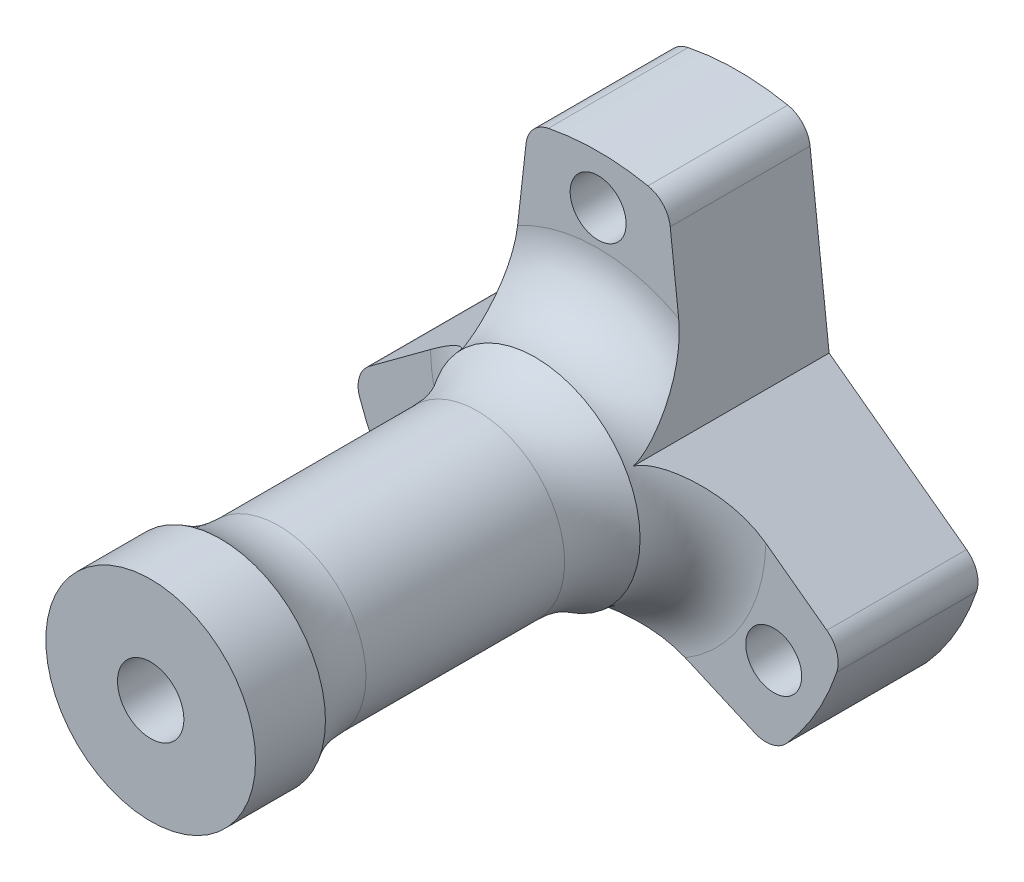
from build123d import *

# Parameters (mm, degrees)
SKETCH1_R           = 4
BOSS_EXTRUDE1_DEPTH = 20
SKETCH2_R           = 15
BOSS_EXTRUDE2_DEPTH = 9
SKETCH3_R           = 12.5
BOSS_EXTRUDE3_DEPTH = 45
SKETCH5_R           = 15
BOSS_EXTRUDE4_DEPTH = 10
FILLET3_R           = 9
FILLET4_R           = 15
SKETCH6_R           = 4.75
CUT_EXTRUDE1_DEPTH  = 20


with BuildPart() as part:
    # Sketch1 → Boss-Extrude1 (new body)
    with BuildSketch(Plane.XY):
        with BuildLine():
            Line((10.311065776, 31.812768666), (13.037811649, 7.527384065))
            Line((13.037811649, 7.527384065), (32.706198717, -6.976739431))
            ThreePointArc((32.706198717, -6.976739431), (34.146892061, -8.992770752), (34.123690383, -11.470560347))
            ThreePointArc((34.123690383, -11.470560347), (31.176914536, -18), (26.995641847, -23.816702569))
            ThreePointArc((26.995641847, -23.816702569), (24.861413952, -25.075690609), (22.395132941, -24.836029235))
            Line((22.395132941, -24.836029235), (0, -15.05476813))
            Line((0, -15.05476813), (-22.395132941, -24.836029235))
            ThreePointArc((-22.395132941, -24.836029235), (-24.861413952, -25.075690609), (-26.995641847, -23.816702569))
            ThreePointArc((-26.995641847, -23.816702569), (-31.176914536, -18), (-34.123690383, -11.470560347))
            ThreePointArc((-34.123690383, -11.470560347), (-34.146892061, -8.992770752), (-32.706198717, -6.976739431))
            Line((-32.706198717, -6.976739431), (-13.037811649, 7.527384065))
            Line((-13.037811649, 7.527384065), (-10.311065776, 31.812768666))
            ThreePointArc((-10.311065776, 31.812768666), (-9.285478109, 34.068461361), (-7.128048535, 35.287262916))
            ThreePointArc((-7.128048535, 35.287262916), (0, 36), (7.128048535, 35.287262916))
            ThreePointArc((7.128048535, 35.287262916), (9.285478109, 34.068461361), (10.311065776, 31.812768666))
        make_face()
        with Locations((0, 29)):
            Circle(SKETCH1_R, mode=Mode.SUBTRACT)
        with Locations((-25.11473671, -14.5)):
            Circle(SKETCH1_R, mode=Mode.SUBTRACT)
        with Locations((25.11473671, -14.5)):
            Circle(SKETCH1_R, mode=Mode.SUBTRACT)
    extrude(amount=BOSS_EXTRUDE1_DEPTH)

    # Sketch2 → Boss-Extrude2 (add)
    with BuildSketch(Plane.XY.offset(20)):
        with Locations(Location((0, 0, 0), (0, 0, 180))):
            Circle(SKETCH2_R)
    extrude(amount=BOSS_EXTRUDE2_DEPTH)

    # Sketch3 → Boss-Extrude3 (add)
    with BuildSketch(Plane.XY.offset(29)):
        with Locations(Location((0, 0, 0), (0, 0, 180))):
            Circle(SKETCH3_R)
    extrude(amount=BOSS_EXTRUDE3_DEPTH)

    # Sketch5 → Boss-Extrude4 (add)
    with BuildSketch(Plane.XY.offset(74)):
        with Locations(Location((0, 0, 0), (0, 0, 180))):
            Circle(SKETCH5_R)
    extrude(amount=BOSS_EXTRUDE4_DEPTH)

    # Fillet3
    # the kernel refuses this fillet: 9 mm, written as the material it adds along each edge
    with BuildSketch(Plane(origin=(0, 0, 20), x_dir=(-1, 0, 0), z_dir=(0, 1, 0))) as fillet3_piece_1_section:
        with BuildLine():
            CenterArc((15 + FILLET3_R, FILLET3_R), FILLET3_R, 180, 90)
            Line((15 + FILLET3_R, 0), (15, 0))
            Line((15, 0), (15, FILLET3_R))
        make_face()
    fillet3_piece_1 = revolve(axis=Axis((0, 0, 20), (0, 0, 1)), mode=Mode.PRIVATE)
    fillet3_piece_1 = split(fillet3_piece_1, bisect_by=Plane(origin=(-2.104235359, 18.693633693, 22.074494406), z_dir=(-0.5935073720778344, -0.8048285527298736, 0)), keep=Keep.TOP, mode=Mode.PRIVATE)
    fillet3_piece_1 = split(fillet3_piece_1, bisect_by=Plane(origin=(-19.127560762, 3.036600307, 22.074494406), z_dir=(0.5935073720778299, -0.8048285527298771, 0)), keep=Keep.TOP, mode=Mode.PRIVATE)
    fillet3_piece_1 = split(fillet3_piece_1, bisect_by=Plane(origin=(-8.489861011, -18.762785739, 22.074494406), z_dir=(-0.4002482863162174, 0.9164067379176843, 0)), keep=Keep.TOP, mode=Mode.PRIVATE)
    add(fillet3_piece_1)
    with BuildSketch(Plane(origin=(0, 0, 20), x_dir=(-1, 0, 0), z_dir=(0, 1, 0))) as fillet3_piece_2_section:
        with BuildLine():
            CenterArc((15 + FILLET3_R, FILLET3_R), FILLET3_R, 180, 90)
            Line((15 + FILLET3_R, 0), (15, 0))
            Line((15, 0), (15, FILLET3_R))
        make_face()
    fillet3_piece_2 = revolve(axis=Axis((0, 0, 20), (0, 0, 1)), mode=Mode.PRIVATE)
    fillet3_piece_2 = split(fillet3_piece_2, bisect_by=Plane(origin=(12.004118745, 16.733826801, 22.074494266), z_dir=(-0.9937556583940517, -0.11157818518780918, 0)), keep=Keep.TOP, mode=Mode.PRIVATE)
    fillet3_piece_2 = split(fillet3_piece_2, bisect_by=Plane(origin=(-12.193553488, 15.046652486, 22.074494266), z_dir=(0.9937556583940516, -0.1115781851878097, 0)), keep=Keep.TOP, mode=Mode.PRIVATE)
    fillet3_piece_2 = split(fillet3_piece_2, bisect_by=Plane(origin=(-17.241277087, -7.524496557, 22.074494266), z_dir=(0.4002482863162113, 0.916406737917687, 0)), keep=Keep.TOP, mode=Mode.PRIVATE)
    add(fillet3_piece_2)
    with BuildSketch(Plane(origin=(0, 0, 20), x_dir=(-1, 0, 0), z_dir=(0, 1, 0))) as fillet3_piece_3_section:
        with BuildLine():
            CenterArc((15 + FILLET3_R, FILLET3_R), FILLET3_R, 180, 90)
            Line((15 + FILLET3_R, 0), (15, 0))
            Line((15, 0), (15, FILLET3_R))
        make_face()
    fillet3_piece_3 = revolve(axis=Axis((0, 0, 20), (0, 0, 1)), mode=Mode.PRIVATE)
    fillet3_piece_3 = split(fillet3_piece_3, bisect_by=Plane(origin=(12.39704086, -20.469279127, 20.602322319), z_dir=(0.4002482863162113, 0.916406737917687, 0)), keep=Keep.TOP, mode=Mode.PRIVATE)
    fillet3_piece_3 = split(fillet3_piece_3, bisect_by=Plane(origin=(16.223816266, -7.968881057, 20.602322319), z_dir=(0.4002482863162174, -0.9164067379176843, 0)), keep=Keep.TOP, mode=Mode.PRIVATE)
    add(fillet3_piece_3)

    # Fillet4
    # the kernel refuses this fillet: 15 mm, written as the material it adds along each edge
    with BuildSketch(Plane(origin=(0, 0, 29), x_dir=(-1, 0, 0), z_dir=(0, 1, 0))) as fillet4_piece_1:
        with BuildLine():
            CenterArc((27.5, 8.291561976), FILLET4_R, 180, 33.557309762)
            Line((12.5, 8.291561976), (12.5, 0))
            Line((12.5, 0), (15, 0))
        make_face()
    revolve(axis=Axis((0, 0, 29), (0, 0, 1)))
    with BuildSketch(Plane(origin=(0, 0, 74), x_dir=(-1, 0, 0), z_dir=(0, 1, 0))) as fillet4_piece_2:
        with BuildLine():
            CenterArc((27.5, -8.291561976), FILLET4_R, 146.442690238, 33.557309762)
            Line((15, 0), (12.5, 0))
            Line((12.5, 0), (12.5, -8.291561976))
        make_face()
    revolve(axis=Axis((0, 0, 74), (0, 0, 1)))

    # Sketch6 → Cut-Extrude1 (cut)
    with BuildSketch(Plane.XY.offset(84)):
        Circle(SKETCH6_R)
    extrude(amount=-CUT_EXTRUDE1_DEPTH, mode=Mode.SUBTRACT)


solid = part.part
